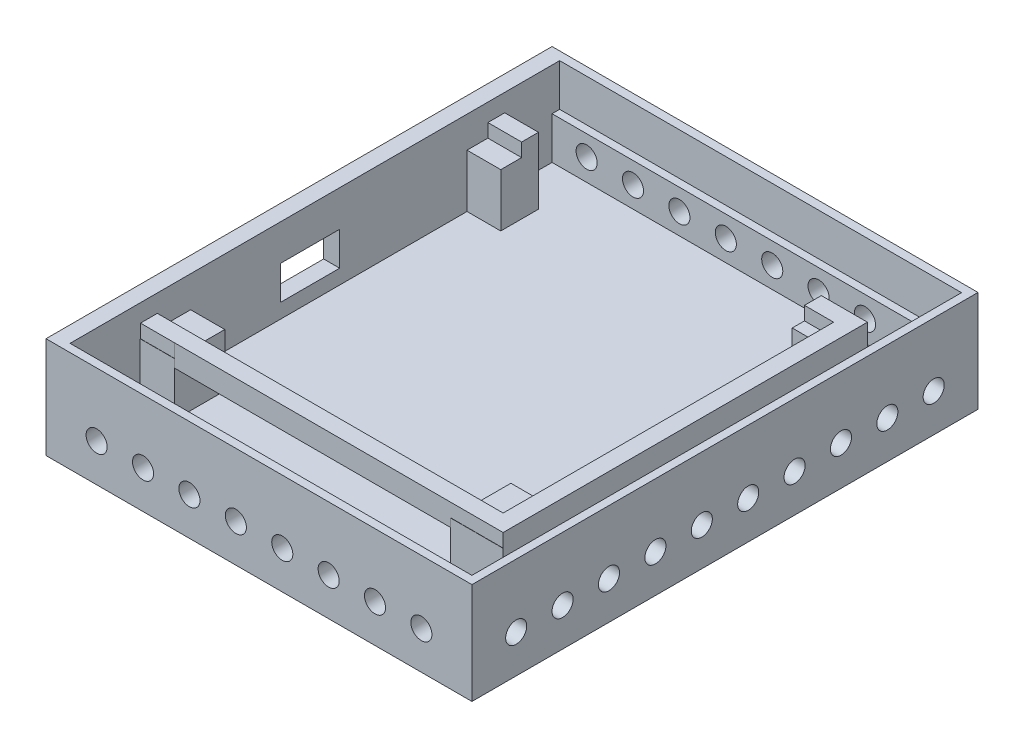
from build123d import *

# Parameters (mm, degrees)
SCHIZZO1_W                    = 50.5
SCHIZZO1_H                    = 60
ESTRUSIONE_ESTRUSIONE1_DEPTH  = 2
SCHIZZO2_W                    = 1.9
SCHIZZO2_H                    = 60
ESTRUSIONE_ESTRUSIONE2_DEPTH  = 10
SCHIZZO3_W                    = 48.6
SCHIZZO3_H                    = 1.9
ESTRUSIONE_ESTRUSIONE3_DEPTH  = 10
SCHIZZO4_W                    = 1.9
SCHIZZO4_H                    = 58.1
ESTRUSIONE_ESTRUSIONE4_DEPTH  = 10
SCHIZZO5_W                    = 46.7
SCHIZZO5_H                    = 1.9
ESTRUSIONE_ESTRUSIONE5_DEPTH  = 10
SCHIZZO8_W                    = 4
SCHIZZO8_H                    = 7
ESTRUSIONE_ESTRUSIONE6_DEPTH  = 6.3
SCHIZZO13_W                   = 5.860494721
SCHIZZO13_H                   = 5.979095524
ESTRUSIONE_ESTRUSIONE12_DEPTH = 6.3
SCHIZZO14_W                   = 6.597450739
SCHIZZO14_H                   = 7.143592965
ESTRUSIONE_ESTRUSIONE13_DEPTH = 6.3
SCHIZZO15_W                   = 4.05309551
SCHIZZO15_H                   = 5.969817473
ESTRUSIONE_ESTRUSIONE14_DEPTH = 6.3
SCHIZZO16_W                   = 4
SCHIZZO16_H                   = 2
ESTRUSIONE_ESTRUSIONE15_DEPTH = 1.6
SCHIZZO17_W                   = 3.463606933
SCHIZZO17_H                   = 2
ESTRUSIONE_ESTRUSIONE16_DEPTH = 1.6
SCHIZZO18_W                   = 2
SCHIZZO18_H                   = 5.261209452
ESTRUSIONE_ESTRUSIONE17_DEPTH = 1.6
SCHIZZO19_W                   = 2
SCHIZZO19_H                   = 5.1200622
ESTRUSIONE_ESTRUSIONE18_DEPTH = 1.6
SCHIZZO23_W                   = 6.200562951
SCHIZZO23_H                   = 2
ESTRUSIONE_ESTRUSIONE19_DEPTH = 1.6
SCHIZZO25_W                   = 4.05309551
SCHIZZO25_H                   = 2
ESTRUSIONE_ESTRUSIONE20_DEPTH = 1.6
SCHIZZO26_W                   = 0.396887788
SCHIZZO26_H                   = 7.143592965
TAGLIO_ESTRUSIONE1_DEPTH      = 6.3
SCHIZZO27_W                   = 0.396887788
SCHIZZO27_H                   = 5.979095524
TAGLIO_ESTRUSIONE2_DEPTH      = 6.3
SCHIZZO28_W                   = 5.463606933
SCHIZZO28_H                   = 0.717886072
TAGLIO_ESTRUSIONE3_DEPTH      = 6.3
SCHIZZO29_W                   = 4
SCHIZZO29_H                   = 2.528965469
TAGLIO_ESTRUSIONE4_DEPTH      = 6.3
SCHIZZO30_W                   = 2
SCHIZZO30_H                   = 1.6
ESTRUSIONE_ESTRUSIONE21_DEPTH = 33.3
SCHIZZO31_W                   = 2
SCHIZZO31_H                   = 1.6
ESTRUSIONE_ESTRUSIONE22_DEPTH = 35
SCHIZZO32_W                   = 32.746341539
SCHIZZO32_H                   = 2.532165246
ESTRUSIONE_ESTRUSIONE23_DEPTH = 1
SCHIZZO33_W                   = 2.312046238
SCHIZZO33_H                   = 32.62188442
ESTRUSIONE_ESTRUSIONE24_DEPTH = 1
SCHIZZO34_W                   = 7
SCHIZZO34_H                   = 4
TAGLIO_ESTRUSIONE5_DEPTH      = 1.9
SCHIZZO35_W                   = 0.95
SCHIZZO35_H                   = 56.2
TAGLIO_ESTRUSIONE6_DEPTH      = 5
SCHIZZO36_W                   = 47.65
SCHIZZO36_H                   = 0.95
TAGLIO_ESTRUSIONE7_DEPTH      = 5
SCHIZZO38_W                   = 47.65
SCHIZZO38_H                   = 0.9
TAGLIO_ESTRUSIONE8_DEPTH      = 5
SCHIZZO39_W                   = 5.463606933
SCHIZZO39_H                   = 1.811079397
TAGLIO_ESTRUSIONE9_DEPTH      = 7.9
SCHIZZO40_R                   = 1.25
TAGLIO_ESTRUSIONE10_DEPTH     = 2
SCHIZZO41_R                   = 1.25
TAGLIO_ESTRUSIONE11_DEPTH     = 2
SCHIZZO42_R                   = 1.25
TAGLIO_ESTRUSIONE12_DEPTH     = 2


with BuildPart() as part:
    # Schizzo1 → Estrusione-Estrusione1 (new body)
    with BuildSketch(Plane(origin=(0, 0, 0), x_dir=(1, 0, 0), z_dir=(0, 1, 0))):
        with Locations((25.25, 30)):
            Rectangle(SCHIZZO1_W, SCHIZZO1_H)
    extrude(amount=ESTRUSIONE_ESTRUSIONE1_DEPTH)

    # Schizzo2 → Estrusione-Estrusione2 (add)
    with BuildSketch(Plane(origin=(0, 2, 0), x_dir=(1, 0, 0), z_dir=(0, 1, 0))):
        with Locations((0.95, 30)):
            Rectangle(SCHIZZO2_W, SCHIZZO2_H)
    extrude(amount=ESTRUSIONE_ESTRUSIONE2_DEPTH)

    # Schizzo3 → Estrusione-Estrusione3 (add)
    with BuildSketch(Plane(origin=(0, 2, 0), x_dir=(1, 0, 0), z_dir=(0, 1, 0))):
        with Locations((26.2, 59.05)):
            Rectangle(SCHIZZO3_W, SCHIZZO3_H)
    extrude(amount=ESTRUSIONE_ESTRUSIONE3_DEPTH)

    # Schizzo4 → Estrusione-Estrusione4 (add)
    with BuildSketch(Plane(origin=(0, 2, 0), x_dir=(1, 0, 0), z_dir=(0, 1, 0))):
        with Locations((49.55, 29.05)):
            Rectangle(SCHIZZO4_W, SCHIZZO4_H)
    extrude(amount=ESTRUSIONE_ESTRUSIONE4_DEPTH)

    # Schizzo5 → Estrusione-Estrusione5 (add)
    with BuildSketch(Plane(origin=(0, 2, 0), x_dir=(1, 0, 0), z_dir=(0, 1, 0))):
        with Locations((25.25, 0.95)):
            Rectangle(SCHIZZO5_W, SCHIZZO5_H)
    extrude(amount=ESTRUSIONE_ESTRUSIONE5_DEPTH)

    # Schizzo8 → Estrusione-Estrusione6 (add)
    with BuildSketch(Plane(origin=(0, 2, 0), x_dir=(1, 0, 0), z_dir=(0, 1, 0))):
        with Locations((3.9, 51.517401634)):
            Rectangle(SCHIZZO8_W, SCHIZZO8_H)
    extrude(amount=ESTRUSIONE_ESTRUSIONE6_DEPTH)

    # Schizzo13 → Estrusione-Estrusione12 (add)
    with BuildSketch(Plane(origin=(0, 2, 0), x_dir=(1, 0, 0), z_dir=(0, 1, 0))):
        with Locations((42.366640428, 52.027853872)):
            Rectangle(SCHIZZO13_W, SCHIZZO13_H)
    extrude(amount=ESTRUSIONE_ESTRUSIONE12_DEPTH)

    # Schizzo14 → Estrusione-Estrusione13 (add)
    with BuildSketch(Plane(origin=(0, 2, 0), x_dir=(1, 0, 0), z_dir=(0, 1, 0))):
        with Locations((41.998162419, 12.844625208)):
            Rectangle(SCHIZZO14_W, SCHIZZO14_H)
    extrude(amount=ESTRUSIONE_ESTRUSIONE13_DEPTH)

    # Schizzo15 → Estrusione-Estrusione14 (add)
    with BuildSketch(Plane(origin=(0, 2, 0), x_dir=(1, 0, 0), z_dir=(0, 1, 0))):
        with Locations((3.926547755, 12.257737461)):
            Rectangle(SCHIZZO15_W, SCHIZZO15_H)
    extrude(amount=ESTRUSIONE_ESTRUSIONE14_DEPTH)

    # Schizzo16 → Estrusione-Estrusione15 (add)
    with BuildSketch(Plane(origin=(0, 8.3, 0), x_dir=(1, 0, 0), z_dir=(0, 1, 0))):
        with Locations((3.9, 51.488436165)):
            Rectangle(SCHIZZO16_W, SCHIZZO16_H)
    extrude(amount=ESTRUSIONE_ESTRUSIONE15_DEPTH)

    # Schizzo17 → Estrusione-Estrusione16 (add)
    with BuildSketch(Plane(origin=(0, 8.3, 0), x_dir=(1, 0, 0), z_dir=(0, 1, 0))):
        with Locations((41.168196534, 51.488436165)):
            Rectangle(SCHIZZO17_W, SCHIZZO17_H)
    extrude(amount=ESTRUSIONE_ESTRUSIONE16_DEPTH)

    # Schizzo18 → Estrusione-Estrusione17 (add)
    with BuildSketch(Plane(origin=(0, 8.3, 0), x_dir=(1, 0, 0), z_dir=(0, 1, 0))):
        with Locations((43.9, 51.668910836)):
            Rectangle(SCHIZZO18_W, SCHIZZO18_H)
    extrude(amount=ESTRUSIONE_ESTRUSIONE17_DEPTH)

    # Schizzo19 → Estrusione-Estrusione18 (add)
    with BuildSketch(Plane(origin=(0, 8.3, 0), x_dir=(1, 0, 0), z_dir=(0, 1, 0))):
        with Locations((43.9, 13.860505662)):
            Rectangle(SCHIZZO19_W, SCHIZZO19_H)
    extrude(amount=ESTRUSIONE_ESTRUSIONE18_DEPTH)

    # Schizzo23 → Estrusione-Estrusione19 (add)
    with BuildSketch(Plane(origin=(0, 8.3, 0), x_dir=(1, 0, 0), z_dir=(0, 1, 0))):
        with Locations((41.799718525, 10.300474562)):
            Rectangle(SCHIZZO23_W, SCHIZZO23_H)
    extrude(amount=ESTRUSIONE_ESTRUSIONE19_DEPTH)

    # Schizzo25 → Estrusione-Estrusione20 (add)
    with BuildSketch(Plane(origin=(0, 8.3, 0), x_dir=(1, 0, 0), z_dir=(0, 1, 0))):
        with Locations((3.926547755, 10.299277402)):
            Rectangle(SCHIZZO25_W, SCHIZZO25_H)
    extrude(amount=ESTRUSIONE_ESTRUSIONE20_DEPTH)

    # Schizzo26 → Taglio-Estrusione1 (cut)
    with BuildSketch(Plane(origin=(0, 8.3, 0), x_dir=(1, 0, 0), z_dir=(0, 1, 0))):
        with Locations((45.098443894, 12.844625208)):
            Rectangle(SCHIZZO26_W, SCHIZZO26_H)
    extrude(amount=-TAGLIO_ESTRUSIONE1_DEPTH, mode=Mode.SUBTRACT)

    # Schizzo27 → Taglio-Estrusione2 (cut)
    with BuildSketch(Plane(origin=(0, 8.3, 0), x_dir=(1, 0, 0), z_dir=(0, 1, 0))):
        with Locations((45.098443894, 52.027853872)):
            Rectangle(SCHIZZO27_W, SCHIZZO27_H)
    extrude(amount=-TAGLIO_ESTRUSIONE2_DEPTH, mode=Mode.SUBTRACT)

    # Schizzo28 → Taglio-Estrusione3 (cut)
    with BuildSketch(Plane(origin=(0, 8.3, 0), x_dir=(1, 0, 0), z_dir=(0, 1, 0))):
        with Locations((42.168196534, 54.658458598)):
            Rectangle(SCHIZZO28_W, SCHIZZO28_H)
    extrude(amount=-TAGLIO_ESTRUSIONE3_DEPTH, mode=Mode.SUBTRACT)

    # Schizzo29 → Taglio-Estrusione4 (cut)
    with BuildSketch(Plane(origin=(0, 8.3, 0), x_dir=(1, 0, 0), z_dir=(0, 1, 0))):
        with Locations((3.9, 53.7529189)):
            Rectangle(SCHIZZO29_W, SCHIZZO29_H)
    extrude(amount=-TAGLIO_ESTRUSIONE4_DEPTH, mode=Mode.SUBTRACT)

    # Schizzo30 → Estrusione-Estrusione21 (add)
    with BuildSketch(Plane.XY.offset(-49.03830611)):
        with Locations((43.9, 9.1)):
            Rectangle(SCHIZZO30_W, SCHIZZO30_H)
    extrude(amount=ESTRUSIONE_ESTRUSIONE21_DEPTH)

    # Schizzo31 → Estrusione-Estrusione22 (add)
    with BuildSketch(Plane.ZY.offset(-38.699437049)):
        with Locations((-10.300474562, 9.1)):
            Rectangle(SCHIZZO31_W, SCHIZZO31_H)
    extrude(amount=ESTRUSIONE_ESTRUSIONE22_DEPTH)

    # Schizzo32 → Estrusione-Estrusione23 (add)
    with BuildSketch(Plane(origin=(0, 8.3, 0), x_dir=(-1, 0, 0), z_dir=(0, -1, 0))):
        with Locations((-22.32626628, 10.566557185)):
            Rectangle(SCHIZZO32_W, SCHIZZO32_H)
    extrude(amount=ESTRUSIONE_ESTRUSIONE23_DEPTH)

    # Schizzo33 → Estrusione-Estrusione24 (add)
    with BuildSketch(Plane(origin=(0, 8.3, 0), x_dir=(-1, 0, 0), z_dir=(0, -1, 0))):
        with Locations((-43.743976881, 32.7273639)):
            Rectangle(SCHIZZO33_W, SCHIZZO33_H)
    extrude(amount=ESTRUSIONE_ESTRUSIONE24_DEPTH)

    # Schizzo34 → Taglio-Estrusione5 (cut)
    with BuildSketch(Plane.ZY):
        with Locations((-29.418763507, 5.729573289)):
            Rectangle(SCHIZZO34_W, SCHIZZO34_H)
    extrude(amount=-TAGLIO_ESTRUSIONE5_DEPTH, mode=Mode.SUBTRACT)

    # Schizzo35 → Taglio-Estrusione6 (cut)
    with BuildSketch(Plane(origin=(0, 12, 0), x_dir=(1, 0, 0), z_dir=(0, 1, 0))):
        with Locations((49.075, 30)):
            Rectangle(SCHIZZO35_W, SCHIZZO35_H)
    extrude(amount=-TAGLIO_ESTRUSIONE6_DEPTH, mode=Mode.SUBTRACT)

    # Schizzo36 → Taglio-Estrusione7 (cut)
    with BuildSketch(Plane(origin=(0, 12, 0), x_dir=(1, 0, 0), z_dir=(0, 1, 0))):
        with Locations((25.725, 1.425)):
            Rectangle(SCHIZZO36_W, SCHIZZO36_H)
    extrude(amount=-TAGLIO_ESTRUSIONE7_DEPTH, mode=Mode.SUBTRACT)

    # Schizzo38 → Taglio-Estrusione8 (cut)
    with BuildSketch(Plane(origin=(0, 12, 0), x_dir=(1, 0, 0), z_dir=(0, 1, 0))):
        with Locations((25.725, 58.55)):
            Rectangle(SCHIZZO38_W, SCHIZZO38_H)
    extrude(amount=-TAGLIO_ESTRUSIONE8_DEPTH, mode=Mode.SUBTRACT)

    # Schizzo39 → Taglio-Estrusione9 (cut)
    with BuildSketch(Plane(origin=(0, 9.9, 0), x_dir=(1, 0, 0), z_dir=(0, 1, 0))):
        with Locations((42.168196534, 53.393975864)):
            Rectangle(SCHIZZO39_W, SCHIZZO39_H)
    extrude(amount=-TAGLIO_ESTRUSIONE9_DEPTH, mode=Mode.SUBTRACT)

    # Schizzo40 → Taglio-Estrusione10 (cut)
    with BuildSketch(Plane.ZY.offset(-48.6)):
        with Locations((-54.748306662, 4.5)):
            Circle(SCHIZZO40_R)
        with Locations((-49.251193724, 4.5)):
            Circle(SCHIZZO40_R)
        with Locations((-43.755630985, 4.660639171)):
            Circle(SCHIZZO40_R)
        with Locations((-38.256484567, 4.5)):
            Circle(SCHIZZO40_R)
        with Locations((-32.75704277, 4.5)):
            Circle(SCHIZZO40_R)
        with Locations((-27.253113097, 4.5)):
            Circle(SCHIZZO40_R)
        with Locations((-21.753134715, 4.5)):
            Circle(SCHIZZO40_R)
        with Locations((-16.249446683, 4.5)):
            Circle(SCHIZZO40_R)
        with Locations((-10.749501873, 4.5)):
            Circle(SCHIZZO40_R)
        with Locations((-5.247967863, 4.5)):
            Circle(SCHIZZO40_R)
    extrude(amount=-TAGLIO_ESTRUSIONE10_DEPTH, mode=Mode.SUBTRACT)

    # Schizzo41 → Taglio-Estrusione11 (cut)
    with BuildSketch(Plane(origin=(0, 0, -1.9), x_dir=(-1, 0, 0), z_dir=(0, 0, -1))):
        with Locations((-44.505152639, 4.5)):
            Circle(SCHIZZO41_R)
        with Locations((-39.008510275, 4.5)):
            Circle(SCHIZZO41_R)
        with Locations((-33.512826279, 4.5)):
            Circle(SCHIZZO41_R)
        with Locations((-28.011482842, 4.5)):
            Circle(SCHIZZO41_R)
        with Locations((-22.510007157, 4.5)):
            Circle(SCHIZZO41_R)
        with Locations((-17.005613725, 4.5)):
            Circle(SCHIZZO41_R)
        with Locations((-11.505531713, 4.5)):
            Circle(SCHIZZO41_R)
        with Locations((-6.003529203, 4.5)):
            Circle(SCHIZZO41_R)
    extrude(amount=-TAGLIO_ESTRUSIONE11_DEPTH, mode=Mode.SUBTRACT)

    # Schizzo42 → Taglio-Estrusione12 (cut)
    with BuildSketch(Plane.XY.offset(-58.1)):
        with Locations((44.505171149, 4.604063865)):
            Circle(SCHIZZO42_R)
        with Locations((39.00366439, 4.5)):
            Circle(SCHIZZO42_R)
        with Locations((33.500803503, 4.5)):
            Circle(SCHIZZO42_R)
        with Locations((28.004513403, 4.5)):
            Circle(SCHIZZO42_R)
        with Locations((22.500747738, 4.5)):
            Circle(SCHIZZO42_R)
        with Locations((16.997263313, 4.5)):
            Circle(SCHIZZO42_R)
        with Locations((11.498629399, 4.5)):
            Circle(SCHIZZO42_R)
        with Locations((5.998029724, 4.604063865)):
            Circle(SCHIZZO42_R)
    extrude(amount=-TAGLIO_ESTRUSIONE12_DEPTH, mode=Mode.SUBTRACT)


solid = part.part
